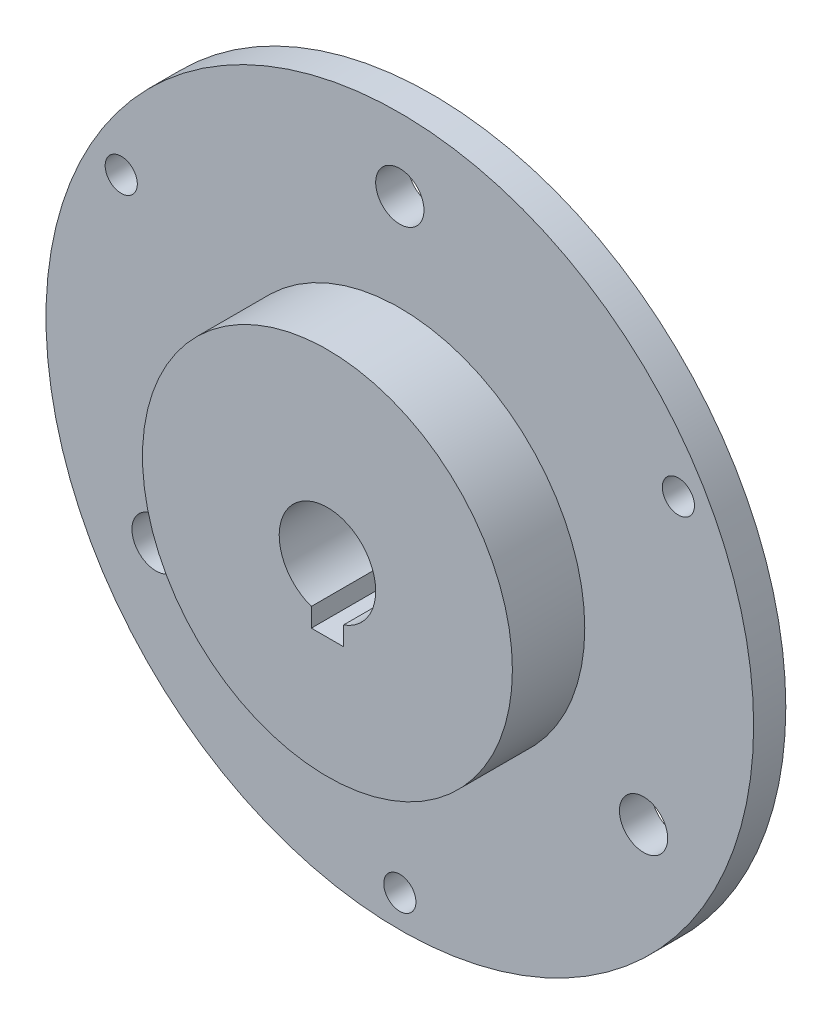
from build123d import *

# Parameters (mm, degrees)
SZKIC2_W                   = 4
SZKIC2_H                   = 3.19901438
WYTNIJ_WYCI_GNI_CIE1_DEPTH = 69.651292777
SZKIC3_R                   = 2
SZKIC3_R_2                 = 3
WYTNIJ_WYCI_GNI_CIE2_DEPTH = 66.360538553


with BuildPart() as part:
    # Szkic1 → Obrót1 (revolve)
    with BuildSketch(Plane(origin=(0, 0, 0), x_dir=(0, 0, -1), z_dir=(1, 0, 0))):
        Polygon((29, 6), (0, 6), (0, 23), (9, 23), (9, 44), (13, 44), (13, 15), (27, 15), (29, 13), align=None)
    revolve(axis=Axis((0, 0, 0), (0, 0, -1)))

    # Szkic2 → Wytnij-wyciągnięcie1 (cut, through all)
    with BuildSketch(Plane.XY):
        with Locations((0, -6.40049281)):
            Rectangle(SZKIC2_W, SZKIC2_H)
    extrude(amount=-WYTNIJ_WYCI_GNI_CIE1_DEPTH, mode=Mode.SUBTRACT)

    # Szkic3 → Wytnij-wyciągnięcie2 (cut, through all)
    with BuildSketch(Plane.XY.offset(-9)):
        with Locations((0, -40)):
            Circle(SZKIC3_R)
        with Locations((0, 35)):
            Circle(SZKIC3_R_2)
        with Locations((30.310889132, -17.5)):
            Circle(SZKIC3_R_2)
        with Locations((-34.641016151, 20)):
            Circle(SZKIC3_R)
        with Locations((-30.310889132, -17.5)):
            Circle(SZKIC3_R_2)
        with Locations((34.641016151, 20)):
            Circle(SZKIC3_R)
    extrude(amount=-WYTNIJ_WYCI_GNI_CIE2_DEPTH, mode=Mode.SUBTRACT)


solid = part.part
